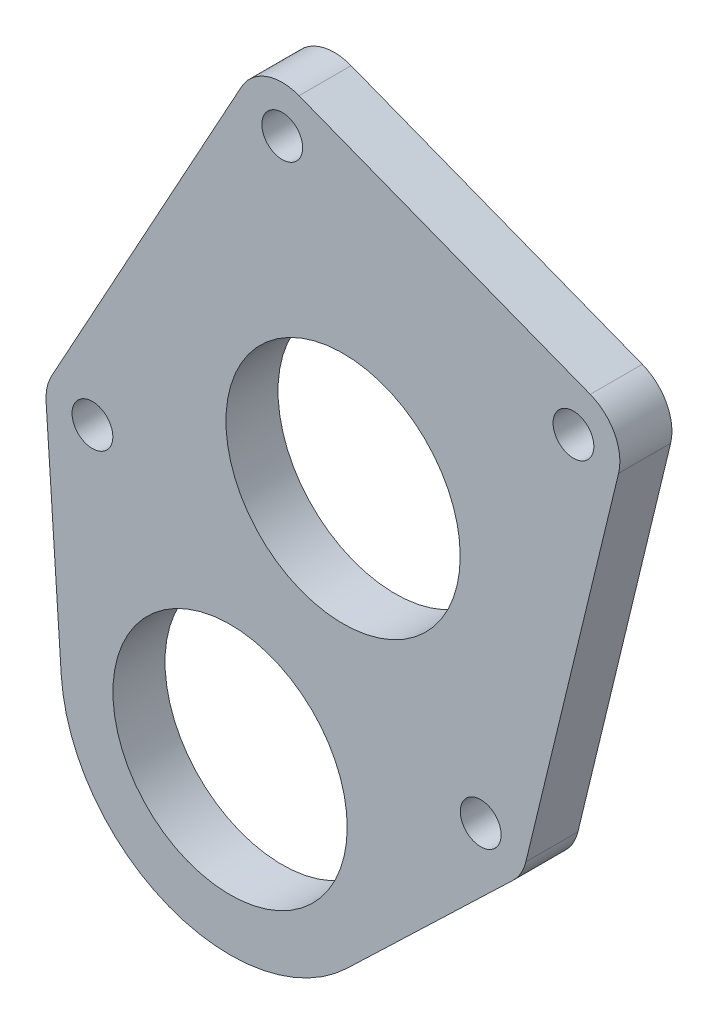
from build123d import *

# Parameters (mm, degrees)
SKETCH1_R           = 14.2875
SKETCH1_R_2         = 2.4892
BOSS_EXTRUDE1_DEPTH = 3.175


with BuildPart() as part:
    # Sketch1 → Boss-Extrude1 (new, symmetric)
    with BuildSketch(Plane.XY):
        with BuildLine():
            Line((-22.439238672, 26.575360039), (-20.592558937, -1.361221017))
            ThreePointArc((-20.592558937, -1.361221017), (-7.46638511, -19.239529611), (14.283611798, -14.895799416))
            Line((14.283611798, -14.895799416), (34.491770922, 4.481844711))
            ThreePointArc((34.491770922, 4.481844711), (35.481320255, 5.745895227), (36.076493176, 7.236801253))
            Line((36.076493176, 7.236801253), (47.386757396, 53.933065004))
            ThreePointArc((47.386757396, 53.933065004), (46.901947943, 57.889523088), (43.930968617, 60.546943383))
            Line((43.930968617, 60.546943383), (8.411837029, 74.331038971))
            ThreePointArc((8.411837029, 74.331038971), (4.426011167, 74.373382533), (1.399246347, 71.779679485))
            Line((1.399246347, 71.779679485), (-21.750728403, 29.678114263))
            ThreePointArc((-21.750728403, 29.678114263), (-22.317065639, 28.176017821), (-22.439238672, 26.575360039))
        make_face()
        Circle(SKETCH1_R, mode=Mode.SUBTRACT)
        with Locations((13.784095588, 35.519131589)):
            Circle(SKETCH1_R, mode=Mode.SUBTRACT)
        with Locations((-16.787373265, 26.948962853)):
            Circle(SKETCH1_R_2, mode=Mode.SUBTRACT)
        with Locations((30.571468853, 8.570168736)):
            Circle(SKETCH1_R_2, mode=Mode.SUBTRACT)
        with Locations((41.881733073, 55.266432486)):
            Circle(SKETCH1_R_2, mode=Mode.SUBTRACT)
        with Locations((6.362601485, 69.050528074)):
            Circle(SKETCH1_R_2, mode=Mode.SUBTRACT)
    extrude(amount=BOSS_EXTRUDE1_DEPTH, both=True)


solid = part.part
